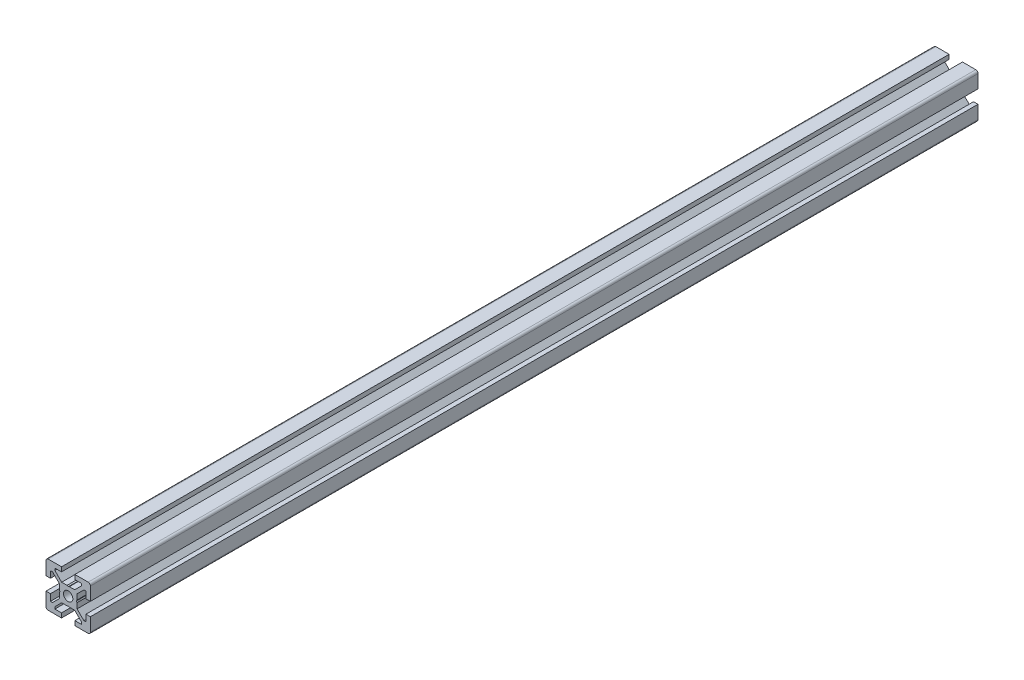
from build123d import *

# Parameters (mm, degrees)
BOSS_EXTRUDE1_DEPTH = 400
SKETCH2_W           = 400
SKETCH2_H           = 2.1


with BuildPart() as part:
    # Sketch1 → Boss-Extrude1 (new body)
    with BuildSketch(Plane.XY):
        with BuildLine():
            Line((-10, -3), (-10, -9))
            ThreePointArc((-10, -9), (-9.707106781, -9.707106781), (-9, -10))
            Line((-9, -10), (-3, -10))
            Line((-3, -10), (-3, -8))
            Line((-3, -8), (-6, -8))
            Line((-6, -8), (-6, -7.060660172))
            Line((-6, -7.060660172), (-2.939339828, -4))
            Line((-2.939339828, -4), (-0.519615242, -4))
            Line((-0.519615242, -4), (0, -3.7))
            Line((0, -3.7), (0.519615242, -4))
            Line((0.519615242, -4), (2.939339828, -4))
            Line((2.939339828, -4), (6, -7.060660172))
            Line((6, -7.060660172), (6, -8))
            Line((6, -8), (3, -8))
            Line((3, -8), (3, -10))
            Line((3, -10), (9, -10))
            ThreePointArc((9, -10), (9.707106781, -9.707106781), (10, -9))
            Line((10, -9), (10, -3))
            Line((10, -3), (8, -3))
            Line((8, -3), (8, -6))
            Line((8, -6), (7.060660172, -6))
            Line((7.060660172, -6), (4, -2.939339828))
            Line((4, -2.939339828), (4, -0.519615242))
            Line((4, -0.519615242), (3.7, 0))
            Line((3.7, 0), (4, 0.519615242))
            Line((4, 0.519615242), (4, 2.939339828))
            Line((4, 2.939339828), (7.060660172, 6))
            Line((7.060660172, 6), (8, 6))
            Line((8, 6), (8, 3))
            Line((8, 3), (10, 3))
            Line((10, 3), (10, 9))
            ThreePointArc((10, 9), (9.707106781, 9.707106781), (9, 10))
            Line((9, 10), (3, 10))
            Line((3, 10), (3, 8))
            Line((3, 8), (6, 8))
            Line((6, 8), (6, 7.060660172))
            Line((6, 7.060660172), (2.939339828, 4))
            Line((2.939339828, 4), (0.519615242, 4))
            Line((0.519615242, 4), (0, 3.7))
            Line((0, 3.7), (-0.519615242, 4))
            Line((-0.519615242, 4), (-2.939339828, 4))
            Line((-2.939339828, 4), (-6, 7.060660172))
            Line((-6, 7.060660172), (-6, 8))
            Line((-6, 8), (-3, 8))
            Line((-3, 8), (-3, 10))
            Line((-3, 10), (-9, 10))
            ThreePointArc((-9, 10), (-9.707106781, 9.707106781), (-10, 9))
            Line((-10, 9), (-10, 3))
            Line((-10, 3), (-8, 3))
            Line((-8, 3), (-8, 6))
            Line((-8, 6), (-7.060660172, 6))
            Line((-7.060660172, 6), (-4, 2.939339828))
            Line((-4, 2.939339828), (-4, 0.519615242))
            Line((-4, 0.519615242), (-3.7, 0))
            Line((-3.7, 0), (-4, -0.519615242))
            Line((-4, -0.519615242), (-4, -2.939339828))
            Line((-4, -2.939339828), (-7.060660172, -6))
            Line((-7.060660172, -6), (-8, -6))
            Line((-8, -6), (-8, -3))
            Line((-8, -3), (-10, -3))
        make_face()
    extrude(amount=-BOSS_EXTRUDE1_DEPTH)

    # Sketch2 → Cut-Revolve1 (revolve, cut)
    with BuildSketch(Plane(origin=(0, 0, 0), x_dir=(0, 0, -1), z_dir=(1, 0, 0))):
        with Locations((200, 1.05)):
            Rectangle(SKETCH2_W, SKETCH2_H)
    revolve(axis=Axis((0, 0, -400), (0, 0, 1)), mode=Mode.SUBTRACT)


solid = part.part
